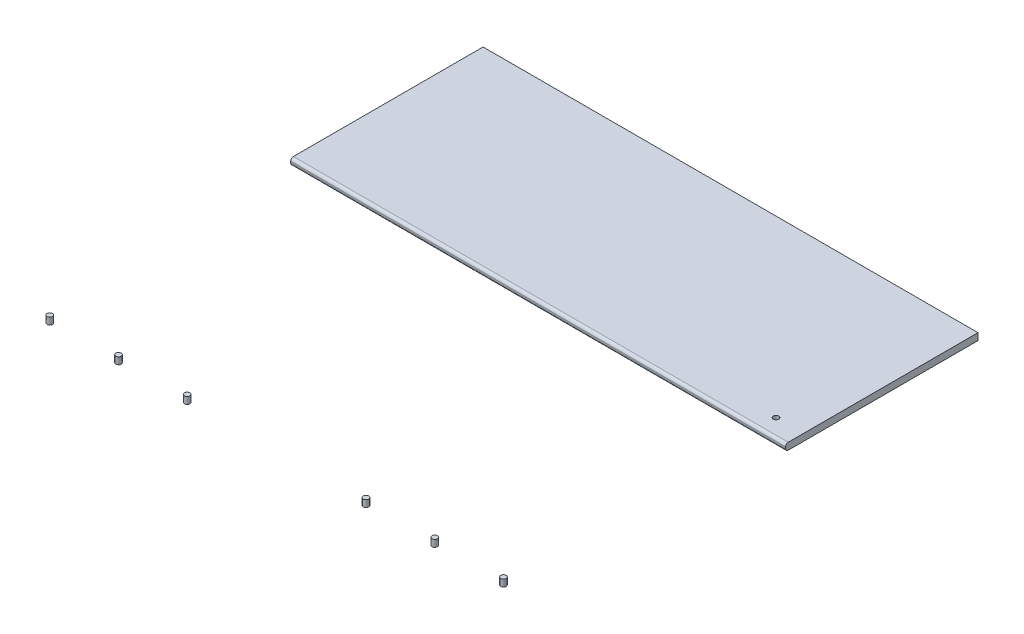
from build123d import *

# Parameters (mm, degrees)
SKETCH1_R             = 2.5019
BOSS_EXTRUDE1_DEPTH   = 6.35
BOSS_EXTRUDE1_2_DEPTH = 6.35
BOSS_EXTRUDE1_3_DEPTH = 6.35
BOSS_EXTRUDE1_4_DEPTH = 6.35
BOSS_EXTRUDE1_5_DEPTH = 6.35
BOSS_EXTRUDE1_6_DEPTH = 6.35
SKETCH1_W             = 457.2
SKETCH1_H             = 177.8
BOSS_EXTRUDE1_7_DEPTH = 6.35
FILLET1_R             = 2.54
SKETCH4_R             = 2.54
CUT_EXTRUDE3_DEPTH    = 400.978507462


with BuildPart() as part:
    # Sketch1 → Boss-Extrude1 (new body)
    with BuildSketch(Plane(origin=(0, 0, 0), x_dir=(1, 0, 0), z_dir=(0, 1, 0))):
        with Locations((204.7875, -325.651301922)):
            Circle(SKETCH1_R)
    extrude(amount=BOSS_EXTRUDE1_DEPTH)


with BuildPart() as body_2:
    # Sketch1 → Boss-Extrude1 2 (new body)
    with BuildSketch(Plane(origin=(0, 0, 0), x_dir=(1, 0, 0), z_dir=(0, 1, 0))):
        with Locations((141.2875, -325.651301922)):
            Circle(SKETCH1_R)
    extrude(amount=BOSS_EXTRUDE1_2_DEPTH)


with BuildPart() as body_3:
    # Sketch1 → Boss-Extrude1 3 (new body)
    with BuildSketch(Plane(origin=(0, 0, 0), x_dir=(1, 0, 0), z_dir=(0, 1, 0))):
        with Locations((77.7875, -325.651301922)):
            Circle(SKETCH1_R)
    extrude(amount=BOSS_EXTRUDE1_3_DEPTH)


with BuildPart() as body_4:
    # Sketch1 → Boss-Extrude1 4 (new body)
    with BuildSketch(Plane(origin=(0, 0, 0), x_dir=(1, 0, 0), z_dir=(0, 1, 0))):
        with Locations((-87.3125, -325.651301922)):
            Circle(SKETCH1_R)
    extrude(amount=BOSS_EXTRUDE1_4_DEPTH)


with BuildPart() as body_5:
    # Sketch1 → Boss-Extrude1 5 (new body)
    with BuildSketch(Plane(origin=(0, 0, 0), x_dir=(1, 0, 0), z_dir=(0, 1, 0))):
        with Locations((-150.8125, -325.651301922)):
            Circle(SKETCH1_R)
    extrude(amount=BOSS_EXTRUDE1_5_DEPTH)


with BuildPart() as body_6:
    # Sketch1 → Boss-Extrude1 6 (new body)
    with BuildSketch(Plane(origin=(0, 0, 0), x_dir=(1, 0, 0), z_dir=(0, 1, 0))):
        with Locations((-214.3125, -325.651301922)):
            Circle(SKETCH1_R)
    extrude(amount=BOSS_EXTRUDE1_6_DEPTH)


with BuildPart() as body_7:
    # Sketch1 → Boss-Extrude1 7 (new body)
    with BuildSketch(Plane(origin=(0, 0, 0), x_dir=(1, 0, 0), z_dir=(0, 1, 0))):
        Rectangle(SKETCH1_W, SKETCH1_H)
    extrude(amount=BOSS_EXTRUDE1_7_DEPTH)

    # Fillet1
    fillet1_edges = [body_7.edges().sort_by_distance(p)[0] for p in [
        (0, 0, 88.9),
        (0, 6.35, 88.9),
    ]]
    fillet(fillet1_edges, radius=FILLET1_R)

    # Sketch4 → Cut-Extrude3 (cut, through all)
    with BuildSketch(Plane.XZ):
        with Locations((203.2, 72.3392)):
            Circle(SKETCH4_R)
    extrude(amount=-CUT_EXTRUDE3_DEPTH, mode=Mode.SUBTRACT)


solid = Compound([part.part, body_2.part, body_3.part, body_4.part, body_5.part, body_6.part, body_7.part])
